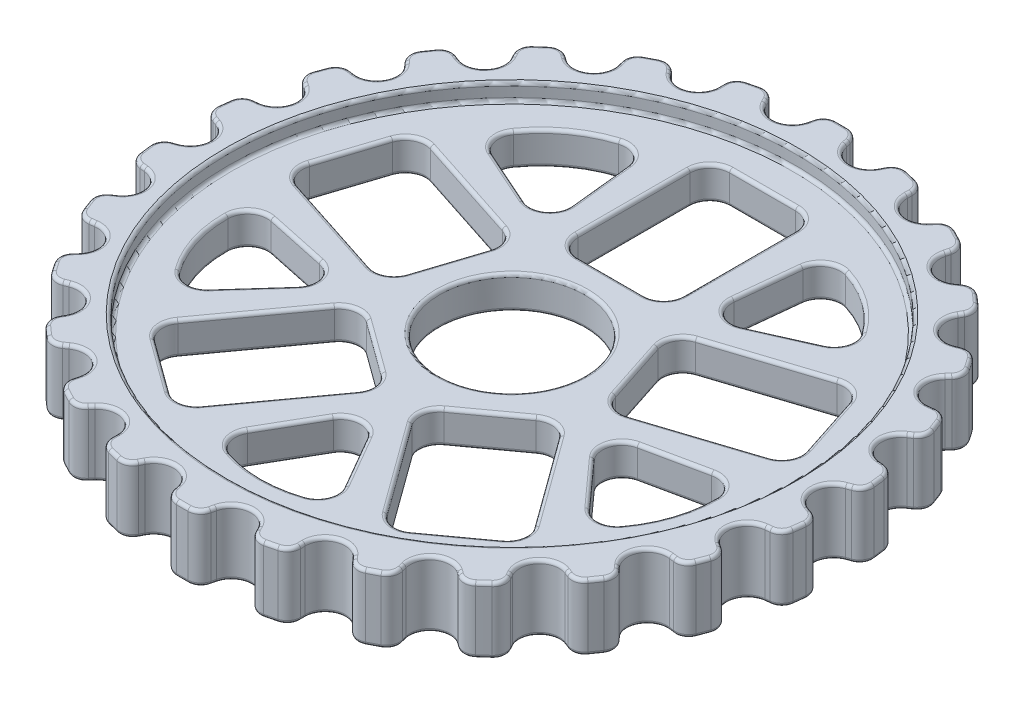
from build123d import *

# Parameters (mm, degrees)
SKETCH_1_W                       = 50
SKETCH_1_H                       = 10
CUT_REVOLVE_START                = -5
CUT_REVOLVE_6_DEPTH              = 10
SKETCH_7_W                       = 8
SKETCH_7_H                       = 23
CUT_REVOLVE_4_ANGLE              = 90
FILLET_4_R                       = 3
PATTERN_CIRCULAR_3_COUNT         = 5
FILLET_4_OF_PATTERN_CIRCULAR_3_R = 3
SKETCH_7_4_W                     = 8
SKETCH_7_4_H                     = 23
CUT_REVOLVE_5_ANGLE              = 90
CUT_REVOLVE_1_DEPTH              = 10
SKETCH_5_W                       = 11
SKETCH_5_H                       = 10
FILLET_1_R                       = 2
FILLET_2_R                       = 3
PATTERN_CIRCULAR_1_COUNT         = 26
FILLET_1_OF_PATTERN_CIRCULAR_1_R = 2
FILLET_2_OF_PATTERN_CIRCULAR_1_R = 3
FILLET_3_R                       = 3
PATTERN_CIRCULAR_2_COUNT         = 5
FILLET_3_OF_PATTERN_CIRCULAR_2_R = 3
SKETCH_11_W                      = 43
SKETCH_11_H                      = 9
FILLET_5_R                       = 0.5


# Read off the part's stored shape, not the designer's step: Вырез-Повернуть6, Вырез-Повернуть1
with BuildPart() as part:
    # Эскиз1 → Повернуть1 (revolve)
    with BuildSketch(Plane.XY, mode=Mode.PRIVATE) as revolve_1_sk:
        with Locations((25, 0)):
            Rectangle(SKETCH_1_W, SKETCH_1_H)
    revolve(revolve_1_sk.sketch.rotate(Axis((0, -5, 0), (0, 1, 0)), 90), axis=Axis((0, -5, 0), (0, 1, 0)))

    # Вырез-Повернуть6 outline → Вырез-Повернуть6 (cut)
    with BuildSketch(Plane(origin=(0, 0, 0), x_dir=(1, 0, 0), z_dir=(0, 1, 0)).offset(CUT_REVOLVE_START)):
        with BuildLine():
            Line((-11.755705046, 16.180339887), (-13.637217385, 34.081734004))
            ThreePointArc((-13.637217385, 34.081734004), (-22.335839587, 30.742645786), (-28.199523283, 23.501599463))
            Line((-28.199523283, 23.501599463), (-11.755705046, 16.180339887))
        make_face()
    cut_revolve_6 = extrude(amount=CUT_REVOLVE_6_DEPTH, mode=Mode.SUBTRACT)

    # Эскиз7 → Вырез-Повернуть4 (revolve, cut)
    with BuildSketch(Plane(origin=(0, 5, 0), x_dir=(1, 0, 0), z_dir=(0, 1, 0))):
        with Locations((-4, 26.5)):
            Rectangle(SKETCH_7_W, SKETCH_7_H)
        with Locations((4, 26.5)):
            Rectangle(SKETCH_7_W, SKETCH_7_H)
    cut_revolve_4 = revolve(axis=Axis((0, 5, -38), (1, 0, 0)), revolution_arc=CUT_REVOLVE_4_ANGLE, mode=Mode.SUBTRACT)

    # Скругление4
    fillet_4_edges = [part.edges().sort_by_distance(p)[0] for p in [
        (-28.199523283, 0, -23.501599463),
        (-11.755705046, 0, -16.180339887),
        (-13.637217385, 0, -34.081734004),
    ]]
    fillet(fillet_4_edges, radius=FILLET_4_R)

    # Круговой массив3: Вырез-Повернуть6 ×5 about axis
    pattern_circular_3_axis = Axis((0, 0, 0), (0, 1, 0))
    for i in range(1, PATTERN_CIRCULAR_3_COUNT):
        add(cut_revolve_6.rotate(pattern_circular_3_axis, i * 360 / PATTERN_CIRCULAR_3_COUNT), mode=Mode.SUBTRACT)

    # Скругление4 of Круговой массив3
    fillet_4_of_pattern_circular_3_edges = [part.edges().sort_by_distance(p)[0] for p in [
        (-31.06548124, 0, 19.556946746),
        (-19.021130325, 0, 6.180339888),
        (-36.627787139, 0, 2.437929453),
        (9, 0, 35.588457268),
        (0, 0, 20),
        (-9, 0, 35.588457268),
        (36.627787139, 0, 2.437929453),
        (19.021130326, 0, 6.180339887),
        (31.065481241, 0, 19.556946746),
        (13.637217385, 0, -34.081734004),
        (11.755705045, 0, -16.180339887),
        (28.199523283, 0, -23.501599463),
    ]]
    fillet(fillet_4_of_pattern_circular_3_edges, radius=FILLET_4_OF_PATTERN_CIRCULAR_3_R)

    # Эскиз7<4> → Вырез-Повернуть5 (revolve, cut)
    with BuildSketch(Plane(origin=(0, 5, 0), x_dir=(1, 0, 0), z_dir=(0, 1, 0))):
        with Locations((-4, 26.5)):
            Rectangle(SKETCH_7_4_W, SKETCH_7_4_H)
        with Locations((4, 26.5)):
            Rectangle(SKETCH_7_4_W, SKETCH_7_4_H)
    cut_revolve_5 = revolve(axis=Axis((0, 5, -15), (-1, 0, 0)), revolution_arc=CUT_REVOLVE_5_ANGLE, mode=Mode.SUBTRACT)

    # Вырез-Повернуть1 outline → Вырез-Повернуть1 (cut)
    with BuildSketch(Plane(origin=(0, 0, 0), x_dir=(1, 0, 0), z_dir=(0, 1, 0)).offset(CUT_REVOLVE_START)):
        with BuildLine():
            Line((-49.870760692, -3.592663081), (-40, 0))
            Line((-40, 0), (-49.870760692, 3.592663081))
            ThreePointArc((-49.870760692, 3.592663081), (-50, 0), (-49.870760692, -3.592663081))
        make_face()
    cut_revolve_1 = extrude(amount=CUT_REVOLVE_1_DEPTH, mode=Mode.SUBTRACT)

    # Эскиз5 → Вырез-Повернуть2 (revolve, cut)
    with BuildSketch(Plane(origin=(0, 0, 0), x_dir=(0, 0, -1), z_dir=(1, 0, 0)), mode=Mode.PRIVATE) as cut_revolve_2_sk:
        with Locations((-5.5, 0)):
            Rectangle(SKETCH_5_W, SKETCH_5_H)
    revolve(cut_revolve_2_sk.sketch.rotate(Axis((0, -5, 0), (0, 1, 0)), 180), axis=Axis((0, -5, 0), (0, 1, 0)), mode=Mode.SUBTRACT)

    # Скругление1
    fillet_1_edges = [part.edges().sort_by_distance(p)[0] for p in [
        (-49.870760692, 0, -3.592663081),
        (-49.870760692, 0, 3.592663081),
    ]]
    fillet(fillet_1_edges, radius=FILLET_1_R)

    # Скругление2
    fillet_2_edges = [part.edges().sort_by_distance(p)[0] for p in [
        (-40, 0, 0),
    ]]
    fillet(fillet_2_edges, radius=FILLET_2_R)

    # Круговой массив1: Вырез-Повернуть1 ×26 about axis
    pattern_circular_1_axis = Axis((0, 0, 0), (0, 1, 0))
    for i in range(1, PATTERN_CIRCULAR_1_COUNT):
        add(cut_revolve_1.rotate(pattern_circular_1_axis, i * 360 / PATTERN_CIRCULAR_1_COUNT), mode=Mode.SUBTRACT)

    # Скругление1 of Круговой массив1
    fillet_1_of_pattern_circular_1_edges = [part.edges().sort_by_distance(p)[0] for p in [
        (-49.281387575, 0, 8.446587402),
        (-47.561826471, 0, 15.423121045),
        (-45.827959342, 0, 19.994952928),
        (-42.488771776, 0, 26.357243274),
        (-39.71117669, 0, 30.381284468),
        (-34.946424105, 0, 35.759578329),
        (-31.286524793, 0, 39.001966186),
        (-25.373117291, 0, 43.083696673),
        (-21.043613797, 0, 45.355995396),
        (-14.325217127, 0, 47.903947168),
        (-9.577724458, 0, 49.074099016),
        (-2.444787413, 0, 49.940194378),
        (2.444787413, 0, 49.940194378),
        (9.577724458, 0, 49.074099016),
        (14.325217127, 0, 47.903947168),
        (21.043613797, 0, 45.355995396),
        (25.373117291, 0, 43.083696673),
        (31.286524793, 0, 39.001966186),
        (34.946424105, 0, 35.759578329),
        (39.71117669, 0, 30.381284468),
        (42.488771776, 0, 26.357243274),
        (45.827959342, 0, 19.994952928),
        (47.561826471, 0, 15.423121045),
        (49.281387575, 0, 8.446587402),
        (49.870760692, 0, 3.592663081),
        (49.870760692, 0, -3.592663081),
        (49.281387575, 0, -8.446587402),
        (47.561826471, 0, -15.423121045),
        (45.827959342, 0, -19.994952928),
        (42.488771776, 0, -26.357243274),
        (39.71117669, 0, -30.381284468),
        (34.946424105, 0, -35.759578329),
        (31.286524793, 0, -39.001966186),
        (25.373117291, 0, -43.083696673),
        (21.043613797, 0, -45.355995396),
        (14.325217127, 0, -47.903947168),
        (9.577724458, 0, -49.074099016),
        (2.444787413, 0, -49.940194378),
        (-2.444787413, 0, -49.940194378),
        (-9.577724458, 0, -49.074099016),
        (-14.325217127, 0, -47.903947168),
        (-21.043613797, 0, -45.355995396),
        (-25.373117291, 0, -43.083696673),
        (-31.286524793, 0, -39.001966186),
        (-34.946424105, 0, -35.759578329),
        (-39.71117669, 0, -30.381284468),
        (-42.488771776, 0, -26.357243274),
        (-45.827959342, 0, -19.994952928),
        (-47.561826471, 0, -15.423121045),
        (-49.281387575, 0, -8.446587402),
    ]]
    fillet(fillet_1_of_pattern_circular_1_edges, radius=FILLET_1_OF_PATTERN_CIRCULAR_1_R)

    # Скругление2 of Круговой массив1
    fillet_2_of_pattern_circular_1_edges = [part.edges().sort_by_distance(p)[0] for p in [
        (-38.837672697, 0, 9.572626572),
        (-35.418241026, 0, 18.588926882),
        (-29.940429927, 0, 26.52490633),
        (-22.722589869, 0, 32.919354636),
        (-14.184195482, 0, 37.400649707),
        (-4.82146721, 0, 39.708354964),
        (4.82146721, 0, 39.708354964),
        (14.184195482, 0, 37.400649707),
        (22.722589869, 0, 32.919354636),
        (29.940429927, 0, 26.52490633),
        (35.418241026, 0, 18.588926882),
        (38.837672697, 0, 9.572626572),
        (40, 0, 0),
        (38.837672697, 0, -9.572626572),
        (35.418241026, 0, -18.588926882),
        (29.940429927, 0, -26.52490633),
        (22.722589869, 0, -32.919354636),
        (14.184195482, 0, -37.400649707),
        (4.82146721, 0, -39.708354964),
        (-4.82146721, 0, -39.708354964),
        (-14.184195482, 0, -37.400649707),
        (-22.722589869, 0, -32.919354636),
        (-29.940429927, 0, -26.52490633),
        (-35.418241026, 0, -18.588926882),
        (-38.837672697, 0, -9.572626572),
    ]]
    fillet(fillet_2_of_pattern_circular_1_edges, radius=FILLET_2_OF_PATTERN_CIRCULAR_1_R)

    # Скругление3
    fillet_3_edges = [part.edges().sort_by_distance(p)[0] for p in [
        (-8, 0, -15),
        (8, 0, -15),
        (-8, 0, -38),
        (8, 0, -38),
    ]]
    fillet(fillet_3_edges, radius=FILLET_3_R)

    # Круговой массив2: Вырез-Повернуть4, Вырез-Повернуть5 ×5 about axis
    pattern_circular_2_axis = Axis((0, 0, 0), (0, 1, 0))
    add([cut_revolve_4.rotate(pattern_circular_2_axis, i * 360 / PATTERN_CIRCULAR_2_COUNT) for i in range(1, PATTERN_CIRCULAR_2_COUNT)], mode=Mode.SUBTRACT)
    add([cut_revolve_5.rotate(pattern_circular_2_axis, i * 360 / PATTERN_CIRCULAR_2_COUNT) for i in range(1, PATTERN_CIRCULAR_2_COUNT)], mode=Mode.SUBTRACT)

    # Скругление3 of Круговой массив2
    fillet_3_of_pattern_circular_2_edges = [part.edges().sort_by_distance(p)[0] for p in [
        (-16.737983699, 0, 2.973197215),
        (-11.793711789, 0, -12.243707046),
        (-38.612283574, 0, -4.134193656),
        (-33.668011664, 0, -19.351097917),
        (-2.344642829, 0, 16.837536934),
        (-15.288914739, 0, 7.432972897),
        (-15.863703632, 0, 35.444927805),
        (-28.807975542, 0, 26.040363768),
        (15.288914739, 0, 7.432972897),
        (2.344642829, 0, 16.837536934),
        (28.807975542, 0, 26.040363768),
        (15.863703632, 0, 35.444927805),
        (11.793711789, 0, -12.243707046),
        (16.737983699, 0, 2.973197215),
        (33.668011664, 0, -19.351097917),
        (38.612283574, 0, -4.134193656),
    ]]
    fillet(fillet_3_of_pattern_circular_2_edges, radius=FILLET_3_OF_PATTERN_CIRCULAR_2_R)

    # Эскиз11 → Вырез-Повернуть7 (revolve, cut)
    with BuildSketch(Plane.XY, mode=Mode.PRIVATE) as cut_revolve_7_sk:
        with Locations((21.5, 7)):
            Rectangle(SKETCH_11_W, SKETCH_11_H)
    cut_revolve_7 = revolve(cut_revolve_7_sk.sketch.rotate(Axis((0, 11.5, 0), (0, -1, 0)), 270), axis=Axis((0, 11.5, 0), (0, -1, 0)), mode=Mode.SUBTRACT)

    # Зеркальное отражение1: Вырез-Повернуть7 across plane
    add(cut_revolve_7.mirror(Plane.ZX), mode=Mode.SUBTRACT)

    # Скругление5
    fillet_5_edges = [part.edges().sort_by_distance(p)[0] for p in [
        (-19.803960719, 5, 43.918283287),
        (-14.299731304, 5, 46.005762157),
        (-16.230766808, 5, 42.797014794),
        (-16.230766808, -5, 42.797014794),
        (-29.738826751, 5, 37.902699778),
        (-24.894106633, 5, 41.246768624),
        (-26.001126248, 5, 37.669134584),
        (-26.001126248, -5, 37.669134584),
        (-37.94538027, 5, 29.684349129),
        (-34.04172697, 5, 34.090662825),
        (-34.26039474, 5, 30.352061194),
        (-34.26039474, -5, 30.352061194),
        (-43.946686213, 5, 19.740852006),
        (-41.210965873, 5, 24.953331617),
        (-40.528573622, 5, 21.271036332),
        (-40.528573622, -5, 21.271036332),
        (-47.393970493, 5, 8.65008832),
        (-45.985173235, 5, 14.365803478),
        (-44.44137912, 5, 10.953816156),
        (-44.44137912, -5, 10.953816156),
        (-17.302130766, 2.5, 1.865996255),
        (-14.631448699, 2.5, -32.992570445),
        (-12.795402156, 2.5, -26.07239711),
        (-13.519060803, 2.5, -18.60739087),
        (-26.856432811, 2.5, -24.110599583),
        (26.856432811, 2.5, -24.110599584),
        (20.842326451, 2.5, -20.22596439),
        (13.519060802, 2.5, -18.607390871),
        (14.631448699, 2.5, -32.992570445),
        (31.229636993, 2.5, 18.091400413),
        (25.676668307, 2.5, 13.572063662),
        (21.874299875, 2.5, 7.10739087),
        (35.899165411, 2.5, 3.720069672),
        (-7.555455693, 2.5, 35.291699943),
        (-4.97327272, 2.5, 28.613961031),
        (0, 2.5, 23),
        (7.555455693, 2.5, 35.291699943),
        (-35.899165411, 2.5, 3.720069672),
        (-28.750319883, 2.5, 4.112336808),
        (-21.874299875, 2.5, 7.107390871),
        (-31.229636992, 2.5, 18.091400413),
        (-22.335839587, 2.5, -30.742645786),
        (-20.842326452, 2.5, -20.22596439),
        (22.335839587, 2.5, -30.742645786),
        (12.795402155, 2.5, -26.072397111),
        (36.140147619, 2.5, 11.742645786),
        (28.750319883, 2.5, 4.112336807),
        (0, 2.5, 38),
        (4.97327272, 2.5, 28.613961031),
        (-36.140147619, 2.5, 11.742645786),
        (-25.676668307, 2.5, 13.572063662),
        (0, 2.5, 11),
        (36.140147619, 2.5, -11.742645786),
        (14.265847744, 2.5, -4.635254916),
        (-22.335839587, 2.5, 30.742645786),
        (-8.816778784, 2.5, 12.135254916),
        (-36.140147619, 2.5, -11.742645786),
        (-14.265847744, 2.5, -4.635254916),
        (22.335839587, 2.5, 30.742645786),
        (8.816778784, 2.5, 12.135254916),
        (0, 2.5, -38),
        (0, 2.5, -15),
        (7.121320344, 2.5, -37.121320344),
        (8, 2.5, -26.5),
        (7.121320344, 2.5, -15.878679656),
        (-7.121320344, 2.5, -15.878679656),
        (-8, 2.5, -26.5),
        (-7.121320344, 2.5, -37.121320344),
        (37.505082615, 2.5, -4.698340722),
        (27.675133637, 2.5, -0.580498221),
        (17.302130766, 2.5, 1.865996255),
        (12.900912749, 2.5, -11.679559979),
        (22.730861727, 2.5, -15.797402481),
        (33.103864598, 2.5, -18.243896957),
        (16.058095463, 2.5, 34.217586086),
        (9.104173231, 2.5, 26.141232369),
        (3.571984548, 2.5, 17.031928765),
        (15.094522908, 2.5, 8.660314616),
        (22.048445141, 2.5, 16.736668333),
        (27.580633824, 2.5, 25.845971937),
        (-27.580633824, 2.5, 25.845971937),
        (-22.048445141, 2.5, 16.736668333),
        (-15.094522908, 2.5, 8.660314616),
        (-3.571984548, 2.5, 17.031928765),
        (-9.104173231, 2.5, 26.141232369),
        (-16.058095463, 2.5, 34.217586086),
        (-33.103864598, 2.5, -18.243896957),
        (-22.730861727, 2.5, -15.797402481),
        (-12.900912749, 2.5, -11.679559979),
        (-27.675133637, 2.5, -0.580498221),
        (-37.505082615, 2.5, -4.698340722),
        (0, 5, 43),
        (0, 2.5, 43),
        (-17.302130766, -2.5, 1.865996255),
        (-26.856432811, -2.5, -24.110599583),
        (-13.519060803, -2.5, -18.60739087),
        (-12.795402156, -2.5, -26.07239711),
        (-14.631448699, -2.5, -32.992570445),
        (14.631448699, -2.5, -32.992570445),
        (13.519060802, -2.5, -18.607390871),
        (20.842326451, -2.5, -20.22596439),
        (26.856432811, -2.5, -24.110599584),
        (35.899165411, -2.5, 3.720069672),
        (21.874299875, -2.5, 7.10739087),
        (25.676668307, -2.5, 13.572063662),
        (31.229636993, -2.5, 18.091400413),
        (7.555455693, -2.5, 35.291699943),
        (0, -2.5, 23),
        (-4.97327272, -2.5, 28.613961031),
        (-7.555455693, -2.5, 35.291699943),
        (-31.229636992, -2.5, 18.091400413),
        (-21.874299875, -2.5, 7.107390871),
        (-28.750319883, -2.5, 4.112336808),
        (-35.899165411, -2.5, 3.720069672),
        (-22.335839587, -2.5, -30.742645786),
        (-20.842326452, -2.5, -20.22596439),
        (22.335839587, -2.5, -30.742645786),
        (12.795402155, -2.5, -26.072397111),
        (36.140147619, -2.5, 11.742645786),
        (28.750319883, -2.5, 4.112336807),
        (0, -2.5, 38),
        (4.97327272, -2.5, 28.613961031),
        (-36.140147619, -2.5, 11.742645786),
        (-25.676668307, -2.5, 13.572063662),
        (0, -2.5, 11),
        (14.265847744, -2.5, -4.635254916),
        (36.140147619, -2.5, -11.742645786),
        (-8.816778784, -2.5, 12.135254916),
        (-22.335839587, -2.5, 30.742645786),
        (0, -2.5, 43),
        (-14.265847744, -2.5, -4.635254916),
        (-36.140147619, -2.5, -11.742645786),
        (8.816778784, -2.5, 12.135254916),
        (22.335839587, -2.5, 30.742645786),
        (0, -2.5, -15),
        (0, -2.5, -38),
        (8, -2.5, -26.5),
        (7.121320344, -2.5, -37.121320344),
        (-7.121320344, -2.5, -37.121320344),
        (-8, -2.5, -26.5),
        (-7.121320344, -2.5, -15.878679656),
        (7.121320344, -2.5, -15.878679656),
        (27.675133637, -2.5, -0.580498221),
        (37.505082615, -2.5, -4.698340722),
        (33.103864598, -2.5, -18.243896957),
        (22.730861727, -2.5, -15.797402481),
        (12.900912749, -2.5, -11.679559979),
        (17.302130766, -2.5, 1.865996255),
        (9.104173231, -2.5, 26.141232369),
        (16.058095463, -2.5, 34.217586086),
        (27.580633824, -2.5, 25.845971937),
        (22.048445141, -2.5, 16.736668333),
        (15.094522908, -2.5, 8.660314616),
        (3.571984548, -2.5, 17.031928765),
        (-22.048445141, -2.5, 16.736668333),
        (-27.580633824, -2.5, 25.845971937),
        (-16.058095463, -2.5, 34.217586086),
        (-9.104173231, -2.5, 26.141232369),
        (-3.571984548, -2.5, 17.031928765),
        (-15.094522908, -2.5, 8.660314616),
        (-22.730861727, -2.5, -15.797402481),
        (-33.103864598, -2.5, -18.243896957),
        (-37.505082615, -2.5, -4.698340722),
        (-27.675133637, -2.5, -0.580498221),
        (-12.900912749, -2.5, -11.679559979),
        (0, -5, 43),
        (-49.635443705, 5, -6.026834013),
        (-49.635443705, -5, -6.026834013),
        (-48.086889478, -5, 2.943387057),
        (-48.086889478, -5, -2.943387057),
        (-49.439701473, -5, -3.885994741),
        (-49.439701473, -5, 3.885994741),
        (-49.439701473, 5, -3.885994741),
        (-49.439701473, 5, 3.885994741),
        (-48.086889478, 5, -2.943387057),
        (-48.086889478, 5, 2.943387057),
        (-45.771413201, 5, 0),
        (-45.771413201, -5, 0),
        (-47.393970493, -5, -8.65008832),
        (-45.985173235, -5, -14.365803478),
        (-46.750812134, -5, -17.730244352),
        (-47.073094189, -5, -15.604769797),
        (-48.933053015, -5, -8.058620204),
        (-46.750812134, 5, -17.730244352),
        (-47.073094189, 5, -15.604769797),
        (-48.933053015, 5, -8.058620204),
        (-43.946686213, -5, -19.740852006),
        (-41.210965873, -5, -24.953331617),
        (-41.149193295, -5, -28.403237337),
        (-41.970769774, -5, -26.416652353),
        (-45.582593379, -5, -19.534897434),
        (-41.149193295, 5, -28.403237337),
        (-41.970769774, 5, -26.416652353),
        (-45.582593379, 5, -19.534897434),
        (-37.94538027, -5, -29.684349129),
        (-34.04172697, -5, -34.090662825),
        (-33.156132912, -5, -37.425537409),
        (-34.429256777, -5, -35.693295095),
        (-39.583039102, -5, -29.875877433),
        (-33.156132912, 5, -37.425537409),
        (-34.429256777, 5, -35.693295095),
        (-39.583039102, 5, -29.875877433),
        (-29.738826751, -5, -37.902699778),
        (-24.894106633, -5, -41.246768624),
        (-23.236158602, -5, -44.272801283),
        (-24.886840521, -5, -42.895573266),
        (-31.283062471, -5, -38.480580029),
        (-23.236158602, 5, -44.272801283),
        (-24.886840521, 5, -42.895573266),
        (-31.283062471, 5, -38.480580029),
        (-19.803960719, -5, -43.918283287),
        (-14.299731304, -5, -46.005762157),
        (-11.965783214, -5, -48.547090871),
        (-13.898091554, -5, -47.604916637),
        (-21.165027958, -5, -44.848931185),
        (-11.965783214, 5, -48.547090871),
        (-13.898091554, 5, -47.604916637),
        (-21.165027958, 5, -44.848931185),
        (-8.718160473, -5, -47.381495808),
        (-2.87430757, -5, -48.091068017),
        (0, -5, -50),
        (-2.101636024, -5, -49.547635291),
        (-9.816958953, -5, -48.61082548),
        (0, 5, -50),
        (-2.101636024, 5, -49.547635291),
        (-9.816958953, 5, -48.61082548),
        (2.87430757, -5, -48.091068017),
        (8.718160473, -5, -47.381495808),
        (11.965783214, -5, -48.547090871),
        (9.816958953, -5, -48.61082548),
        (2.101636024, -5, -49.547635291),
        (11.965783214, 5, -48.547090871),
        (9.816958953, 5, -48.61082548),
        (2.101636024, 5, -49.547635291),
        (14.299731304, -5, -46.005762157),
        (19.803960719, -5, -43.918283287),
        (23.236158602, -5, -44.272801283),
        (21.165027958, -5, -44.848931185),
        (13.898091554, -5, -47.604916637),
        (23.236158602, 5, -44.272801283),
        (21.165027958, 5, -44.848931185),
        (13.898091554, 5, -47.604916637),
        (24.894106633, -5, -41.246768624),
        (29.738826751, -5, -37.902699778),
        (33.156132912, -5, -37.425537409),
        (31.283062471, -5, -38.480580029),
        (24.886840521, -5, -42.895573266),
        (33.156132912, 5, -37.425537409),
        (31.283062471, 5, -38.480580029),
        (24.886840521, 5, -42.895573266),
        (34.04172697, -5, -34.090662825),
        (37.94538027, -5, -29.684349129),
        (41.149193295, -5, -28.403237337),
        (39.583039102, -5, -29.875877433),
        (34.429256777, -5, -35.693295095),
        (41.149193295, 5, -28.403237337),
        (39.583039102, 5, -29.875877433),
        (34.429256777, 5, -35.693295095),
        (41.210965873, -5, -24.953331617),
        (43.946686213, -5, -19.740852006),
        (46.750812134, -5, -17.730244352),
        (45.582593379, -5, -19.534897434),
        (41.970769774, -5, -26.416652353),
        (46.750812134, 5, -17.730244352),
        (45.582593379, 5, -19.534897434),
        (41.970769774, 5, -26.416652353),
        (45.985173235, -5, -14.365803478),
        (47.393970493, -5, -8.65008832),
        (49.635443705, -5, -6.026834013),
        (48.933053015, -5, -8.058620204),
        (47.073094189, -5, -15.604769797),
        (49.635443705, 5, -6.026834013),
        (48.933053015, 5, -8.058620204),
        (47.073094189, 5, -15.604769797),
        (48.086889478, -5, -2.943387057),
        (48.086889478, -5, 2.943387057),
        (49.635443705, -5, 6.026834013),
        (49.439701473, -5, 3.885994741),
        (49.439701473, -5, -3.885994741),
        (49.635443705, 5, 6.026834013),
        (49.439701473, 5, 3.885994741),
        (49.439701473, 5, -3.885994741),
        (47.393970493, -5, 8.65008832),
        (45.985173235, -5, 14.365803478),
        (46.750812134, -5, 17.730244352),
        (47.073094189, -5, 15.604769797),
        (48.933053015, -5, 8.058620204),
        (46.750812134, 5, 17.730244352),
        (47.073094189, 5, 15.604769797),
        (48.933053015, 5, 8.058620204),
        (43.946686213, -5, 19.740852006),
        (41.210965873, -5, 24.953331617),
        (41.149193295, -5, 28.403237337),
        (41.970769774, -5, 26.416652353),
        (45.582593379, -5, 19.534897434),
        (41.149193295, 5, 28.403237337),
        (41.970769774, 5, 26.416652353),
        (45.582593379, 5, 19.534897434),
        (37.94538027, -5, 29.684349129),
        (34.04172697, -5, 34.090662825),
        (33.156132912, -5, 37.425537409),
        (34.429256777, -5, 35.693295095),
        (39.583039102, -5, 29.875877433),
        (33.156132912, 5, 37.425537409),
        (34.429256777, 5, 35.693295095),
        (39.583039102, 5, 29.875877433),
        (29.738826751, -5, 37.902699778),
        (24.894106633, -5, 41.246768624),
        (23.236158602, -5, 44.272801283),
        (24.886840521, -5, 42.895573266),
        (31.283062471, -5, 38.480580029),
        (23.236158602, 5, 44.272801283),
        (24.886840521, 5, 42.895573266),
        (31.283062471, 5, 38.480580029),
        (19.803960719, -5, 43.918283287),
        (14.299731304, -5, 46.005762157),
        (11.965783214, -5, 48.547090871),
        (13.898091554, -5, 47.604916637),
        (21.165027958, -5, 44.848931185),
        (11.965783214, 5, 48.547090871),
        (13.898091554, 5, 47.604916637),
        (21.165027958, 5, 44.848931185),
        (8.718160473, -5, 47.381495808),
        (2.87430757, -5, 48.091068017),
        (0, -5, 50),
        (2.101636024, -5, 49.547635291),
        (9.816958953, -5, 48.61082548),
        (0, 5, 50),
        (2.101636024, 5, 49.547635291),
        (9.816958953, 5, 48.61082548),
        (-2.87430757, -5, 48.091068017),
        (-8.718160473, -5, 47.381495808),
        (-11.965783214, -5, 48.547090871),
        (-9.816958953, -5, 48.61082548),
        (-2.101636024, -5, 49.547635291),
        (-11.965783214, 5, 48.547090871),
        (-9.816958953, 5, 48.61082548),
        (-2.101636024, 5, 49.547635291),
        (-14.299731304, -5, 46.005762157),
        (-19.803960719, -5, 43.918283287),
        (-23.236158602, -5, 44.272801283),
        (-21.165027958, -5, 44.848931185),
        (-13.898091554, -5, 47.604916637),
        (-23.236158602, 5, 44.272801283),
        (-21.165027958, 5, 44.848931185),
        (-13.898091554, 5, 47.604916637),
        (-24.894106633, -5, 41.246768624),
        (-29.738826751, -5, 37.902699778),
        (-33.156132912, -5, 37.425537409),
        (-31.283062471, -5, 38.480580029),
        (-24.886840521, -5, 42.895573266),
        (-33.156132912, 5, 37.425537409),
        (-31.283062471, 5, 38.480580029),
        (-24.886840521, 5, 42.895573266),
        (-34.04172697, -5, 34.090662825),
        (-37.94538027, -5, 29.684349129),
        (-41.149193295, -5, 28.403237337),
        (-39.583039102, -5, 29.875877433),
        (-34.429256777, -5, 35.693295095),
        (-41.149193295, 5, 28.403237337),
        (-39.583039102, 5, 29.875877433),
        (-34.429256777, 5, 35.693295095),
        (-41.210965873, -5, 24.953331617),
        (-43.946686213, -5, 19.740852006),
        (-46.750812134, -5, 17.730244352),
        (-45.582593379, -5, 19.534897434),
        (-41.970769774, -5, 26.416652353),
        (-46.750812134, 5, 17.730244352),
        (-45.582593379, 5, 19.534897434),
        (-41.970769774, 5, 26.416652353),
        (-45.985173235, -5, 14.365803478),
        (-47.393970493, -5, 8.65008832),
        (-49.635443705, -5, 6.026834013),
        (-48.933053015, -5, 8.058620204),
        (-47.073094189, -5, 15.604769797),
        (-49.635443705, 5, 6.026834013),
        (-48.933053015, 5, 8.058620204),
        (-47.073094189, 5, 15.604769797),
        (-45.985173235, 5, -14.365803478),
        (-47.393970493, 5, -8.65008832),
        (-44.44137912, 5, -10.953816156),
        (-44.44137912, -5, -10.953816156),
        (-41.210965873, 5, -24.953331617),
        (-43.946686213, 5, -19.740852006),
        (-40.528573622, 5, -21.271036332),
        (-40.528573622, -5, -21.271036332),
        (-34.04172697, 5, -34.090662825),
        (-37.94538027, 5, -29.684349129),
        (-34.26039474, 5, -30.352061194),
        (-34.26039474, -5, -30.352061194),
        (-24.894106633, 5, -41.246768624),
        (-29.738826751, 5, -37.902699778),
        (-26.001126248, 5, -37.669134584),
        (-26.001126248, -5, -37.669134584),
        (-14.299731304, 5, -46.005762157),
        (-19.803960719, 5, -43.918283287),
        (-16.230766808, 5, -42.797014794),
        (-16.230766808, -5, -42.797014794),
        (-2.87430757, 5, -48.091068017),
        (-8.718160473, 5, -47.381495808),
    ]]
    fillet(fillet_5_edges, radius=FILLET_5_R)


solid = part.part
